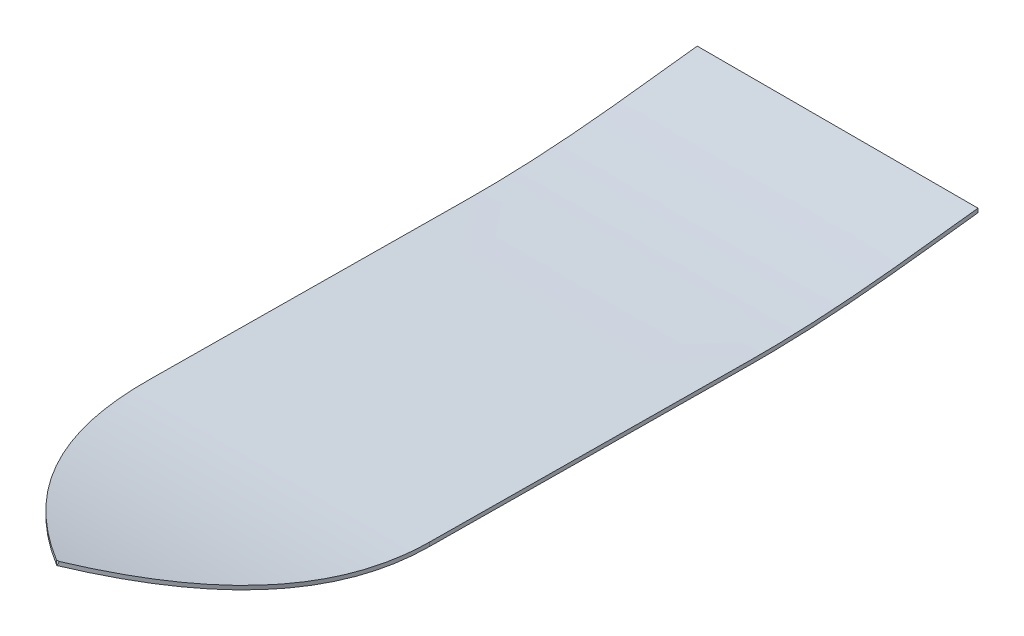
from build123d import *

# Parameters (mm, degrees)
BOSS_EXTRUDE1_DEPTH      = 1524
BOSS_EXTRUDE1_DEPTH_BACK = 1524
CUT_EXTRUDE1_DEPTH       = 3415.181859315
CUT_EXTRUDE1_DEPTH_BACK  = 3415.181859315
SKETCH3_W                = 5731.45735109
SKETCH3_H                = 8003.30588206


with BuildPart() as part:
    # Sketch1 → Boss-Extrude1 (new, two sides: drawn at the far end of the back side and taken through both)
    with BuildSketch(Plane(origin=(0, 0, 0), x_dir=(0, 0, -1), z_dir=(1, 0, 0)).offset(-BOSS_EXTRUDE1_DEPTH_BACK)):
        with BuildLine():
            Line((-3044.269771436, 164.480303416), (-3050.738926444, 140.331803805))
            add(Edge.make_bspline(
                [(-3050.738926444, 140.331803805), (-3039.066644416, 137.204909673), (-3015.722077172, 131.042970079), (-2968.759367062, 119.013169974), (-2909.669072883, 104.561027045), (-2838.102343273, 88.143902976), (-2741.816477706, 67.49190212), (-2619.833936877, 43.995108102), (-2470.857786184, 19.507381338), (-2319.284985797, -1.27335477), (-2165.116507127, -18.348419425), (-2008.352925916, -31.719052572), (-1875.554560722, -39.775732712), (-1768.018797448, -44.369765262), (-1700.268953579, -46.471722182), (-1645.744130987, -47.687202201), (-1604.690569744, -48.377611703), (-1563.448620126, -48.791783672), (-1522.350097611, -49.159717993), (-1481.214576428, -49.539114149), (-1426.379900032, -50.0405935), (-1330.412889074, -50.919465137), (-1193.320295574, -52.173517625), (-1028.808138333, -53.679369021), (-864.29631456, -55.185080682), (-699.784416915, -56.690858809), (-535.27253696, -58.196619142), (-370.760647264, -59.702379894), (-206.248766557, -61.208137383), (-41.736854006, -62.713897515), (95.356306946, -63.968691038), (205.031036435, -64.972528768), (287.28632889, -65.725220945), (355.833748915, -66.352387173), (410.667453669, -66.853583591), (444.947178613, -67.16749514), (472.350668722, -67.417921835), (492.96319571, -67.611356291), (513.492927814, -67.734971093), (540.700760434, -67.820601327), (574.447458869, -67.77760072), (627.891555334, -67.398130206), (693.723193213, -66.355617227), (771.324988467, -64.243769891), (847.695513165, -61.319446738), (948.100047213, -56.401740235), (1071.349035195, -48.466261721), (1216.954104747, -36.472068231), (1361.58580984, -22.396286228), (1482.405091187, -9.256372443), (1579.901279381, 1.907533758), (1653.610554275, 10.558093098), (1728.07409456, 19.43802298), (1790.894591891, 26.988919245), (1841.696227399, 33.096286149), (1880.088643815, 37.703852979), (1912.350584725, 41.561992914), (1938.313285169, 44.654440493), (1951.378549643, 46.205832003), (1957.900922902, 46.978940473)],
                knots=[0, 0, 0, 0, 0.0078125, 0.015625, 0.03125, 0.046875, 0.0625, 0.09375, 0.125, 0.15625, 0.1875, 0.21875, 0.25, 0.265625, 0.28125, 0.2890625, 0.296875, 0.3046875, 0.3125, 0.3203125, 0.328125, 0.34375, 0.375, 0.40625, 0.4375, 0.46875, 0.5, 0.53125, 0.5625, 0.59375, 0.625, 0.640625, 0.65625, 0.671875, 0.6796875, 0.6875, 0.69140625, 0.6953125, 0.69921875, 0.703125, 0.7109375, 0.71875, 0.734375, 0.75, 0.765625, 0.78125, 0.8125, 0.84375, 0.875, 0.90625, 0.921875, 0.9375, 0.953125, 0.96875, 0.9765625, 0.984375, 0.9921875, 0.99609375, 1, 1, 1, 1], degree=3))
            Line((1957.900922902, 46.978940473), (1954.958228564, 71.805147393))
            add(Edge.make_bspline(
                [(-3044.269771436, 164.480303416), (-2812.321731314, 102.343613796), (-2472.360033573, 36.858380573), (-1994.941220074, -9.889338591), (-1747.676160892, -21.185368355), (-1597.512542921, -23.467632465), (-1563.24217593, -23.785486546), (-1460.42372927, -24.728679041), (-1282.201933132, -26.35909182), (-1001.160720007, -28.931327304), (-589.881022496, -32.695753037), (-206.019947714, -36.209183495), (164.131797117, -39.597142558), (337.211934147, -41.181285097), (458.879362891, -42.293389227), (493.156944302, -42.609408123), (566.469070012, -43.081125446), (687.494283675, -42.000847981), (1179.180569042, -25.746852987), (1562.537944101, 25.290875074), (1954.958228564, 71.805147393)],
                knots=[0, 0, 0, 0, 0.15625, 0.21875, 0.2890625, 0.30078125, 0.3046875, 0.30859375, 0.359375, 0.40625, 0.46875, 0.59375, 0.625, 0.6796875, 0.692382812, 0.694335938, 0.69921875, 0.734375, 0.765625, 1, 1, 1, 1], degree=3))
        make_face()
    extrude(amount=BOSS_EXTRUDE1_DEPTH + BOSS_EXTRUDE1_DEPTH_BACK)

    # Sketch3 → Cut-Extrude1 (cut, two sides: drawn at the far end of the back side and taken through both)
    with BuildSketch(Plane(origin=(0, 0, 0), x_dir=(1, 0, 0), z_dir=(0, 1, 0)).offset(-CUT_EXTRUDE1_DEPTH_BACK)):
        with Locations((889.204947701, -540.602321104)):
            Rectangle(SKETCH3_W, SKETCH3_H)
        with BuildLine():
            Line((-900, 1954.958228564), (900, 1954.958228564))
            Line((900, 1954.958228564), (900, -1562.575421989))
            add(Edge.make_bspline(
                [(900, -1562.575421989), (900, -2437.214027172), (0, -3050.738926444)],
                knots=[0, 0, 0, 1, 1, 1], degree=2))
            add(Edge.make_bspline(
                [(-900, -1562.575421989), (-900, -2437.214027172), (0, -3050.738926444)],
                knots=[0, 0, 0, 1, 1, 1], degree=2))
            Line((-900, -1562.575421989), (-900, 1954.958228564))
        make_face(mode=Mode.SUBTRACT)
    extrude(amount=CUT_EXTRUDE1_DEPTH + CUT_EXTRUDE1_DEPTH_BACK, mode=Mode.SUBTRACT)


solid = part.part
